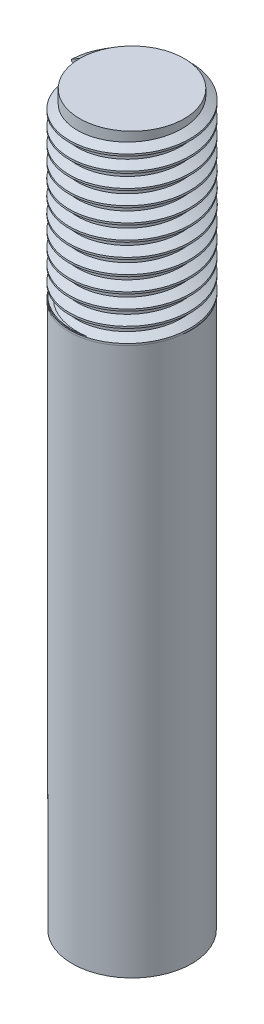
from build123d import *
from build123d.topology import SkipClean

# Parameters (mm, degrees)
SKETCH1_R           = 10
BOSS_EXTRUDE1_DEPTH = 122
CUT_EXTRUDE1_START  = -30
SKETCH4_R           = 10
SKETCH4_R_2         = 8.75
CUT_EXTRUDE1_DEPTH  = 30
THREAD2_PITCH       = 2.5
SKETCH7_R           = 3.375
CUT_EXTRUDE2_DEPTH  = 30
THREAD3_PITCH       = 1.25


with BuildPart() as part:
    # Sketch1 → Boss-Extrude1 (new body)
    with BuildSketch(Plane(origin=(0, 0, 0), x_dir=(1, 0, 0), z_dir=(0, 1, 0))):
        with Locations(Location((0, 0, 0), (0, 0, 90))):
            Circle(SKETCH1_R)
    extrude(amount=BOSS_EXTRUDE1_DEPTH)

    # Sketch4 → Cut-Extrude1 (cut)
    with BuildSketch(Plane(origin=(0, 122, 0), x_dir=(1, 0, 0), z_dir=(0, 1, 0)).offset(CUT_EXTRUDE1_START)):
        with Locations(Location((0, 0, 0), (0, 0, 90))):
            Circle(SKETCH4_R)
        with Locations(Location((0, 0, 0), (0, 0, 270))):
            Circle(SKETCH4_R_2, mode=Mode.SUBTRACT)
    extrude(amount=CUT_EXTRUDE1_DEPTH, mode=Mode.SUBTRACT)

    # Thread2: the profile of Thread Profile2 profile screwed along a right-hand helix of 12 turns, 10 arcs to a turn; built about Z, then put on its axis
    thread2_z = Axis((0, 0, 0), (0, 0, 1))
    thread2_corners = [(8.7497, 0, -0.000173205), (10.103164688, 0, 0.781249997), (10.103164688, 0, 1.093749997), (8.7497, 0, 1.875173198)]
    with BuildLine(mode=Mode.PRIVATE) as thread2_profile:
        Line(thread2_corners[0], thread2_corners[1])
        Line(thread2_corners[1], thread2_corners[2])
        Line(thread2_corners[2], thread2_corners[3])
        Line(thread2_corners[3], thread2_corners[0])
    thread2_cap = Face(thread2_profile.wire())
    thread2_turn_angles = [0, 18, 36, 54, 72, 90, 108, 126, 144, 162, 180, 198, 216, 234, 252, 270, 288, 306, 324, 342, 360]
    thread2_turn_weights = [1, 0.9510565162951535, 1, 0.9510565162951535, 1, 0.9510565162951535, 1, 0.9510565162951535, 1, 0.9510565162951535, 1, 0.9510565162951535, 1, 0.9510565162951535, 1, 0.9510565162951535, 1, 0.9510565162951535, 1, 0.9510565162951535, 1]
    thread2_turn_rails = [Edge.make_bspline([Vector(p[0], p[1], 0).rotate(thread2_z, thread2_turn_angles[k]) / thread2_turn_weights[k] + Vector(0, 0, p[2] + THREAD2_PITCH * thread2_turn_angles[k] / 360) for k in range(21)], [0, 0, 0, 1, 1, 2, 2, 3, 3, 4, 4, 5, 5, 6, 6, 7, 7, 8, 8, 9, 9, 10, 10, 10], 2, thread2_turn_weights) for p in thread2_corners]
    thread2_turn_sides = [Face.make_surface_from_curves(thread2_turn_rails[p[0]], thread2_turn_rails[p[1]]) for p in [(0, 1), (1, 2), (2, 3), (3, 0)]]
    thread2 = Plane(origin=(0, 122, 0), x_dir=(-1, 0, 0), z_dir=(0, -1, 0)) * Solid(Shell([*[p.moved(Location((0, 0, THREAD2_PITCH * i))) for i in range(12) for p in thread2_turn_sides], thread2_cap, thread2_cap.rotate(thread2_z, 4320).moved(Location((0, 0, THREAD2_PITCH * 4320 / 360)))]))
    add(thread2)

    # Sketch7 → Cut-Extrude2 (cut)
    with BuildSketch(Plane.XZ):
        with Locations(Location((0, 0, 0), (0, 0, 270))):
            Circle(SKETCH7_R)
    extrude(amount=-CUT_EXTRUDE2_DEPTH, mode=Mode.SUBTRACT)

    # Thread3: the profile of Thread Profile3 profile screwed along a right-hand helix of 24 turns, 8 arcs to a turn; built about Z, then put on its axis
    with SkipClean():  # the faces are left unmerged after this step: merging them gives an invalid solid
        thread3_z = Axis((0, 0, 0), (0, 0, 1))
        thread3_corners = [(3.3747, 0, -0.000173205), (4.051582344, 0, 0.390624998), (4.051582344, 0, 0.546874998), (3.3747, 0, 0.937673202)]
        with BuildLine(mode=Mode.PRIVATE) as thread3_profile:
            Line(thread3_corners[0], thread3_corners[1])
            Line(thread3_corners[1], thread3_corners[2])
            Line(thread3_corners[2], thread3_corners[3])
            Line(thread3_corners[3], thread3_corners[0])
        thread3_cap = Face(thread3_profile.wire())
        thread3_turn_angles = [0, 22.5, 45, 67.5, 90, 112.5, 135, 157.5, 180, 202.5, 225, 247.5, 270, 292.5, 315, 337.5, 360]
        thread3_turn_weights = [1, 0.9238795325112867, 1, 0.9238795325112867, 1, 0.9238795325112867, 1, 0.9238795325112867, 1, 0.9238795325112867, 1, 0.9238795325112867, 1, 0.9238795325112867, 1, 0.9238795325112867, 1]
        thread3_turn_rails = [Edge.make_bspline([Vector(p[0], p[1], 0).rotate(thread3_z, thread3_turn_angles[k]) / thread3_turn_weights[k] + Vector(0, 0, p[2] + THREAD3_PITCH * thread3_turn_angles[k] / 360) for k in range(17)], [0, 0, 0, 1, 1, 2, 2, 3, 3, 4, 4, 5, 5, 6, 6, 7, 7, 8, 8, 8], 2, thread3_turn_weights) for p in thread3_corners]
        thread3_turn_sides = [Face.make_surface_from_curves(thread3_turn_rails[p[0]], thread3_turn_rails[p[1]]) for p in [(0, 1), (1, 2), (2, 3), (3, 0)]]
        thread3 = Plane(origin=(0, 0, 0), x_dir=(1, 0, 0), z_dir=(0, 1, 0)) * Solid(Shell([*[p.moved(Location((0, 0, THREAD3_PITCH * i))) for i in range(24) for p in thread3_turn_sides], thread3_cap, thread3_cap.rotate(thread3_z, 8640).moved(Location((0, 0, THREAD3_PITCH * 8640 / 360)))]))
        add(thread3, mode=Mode.SUBTRACT)


solid = part.part
